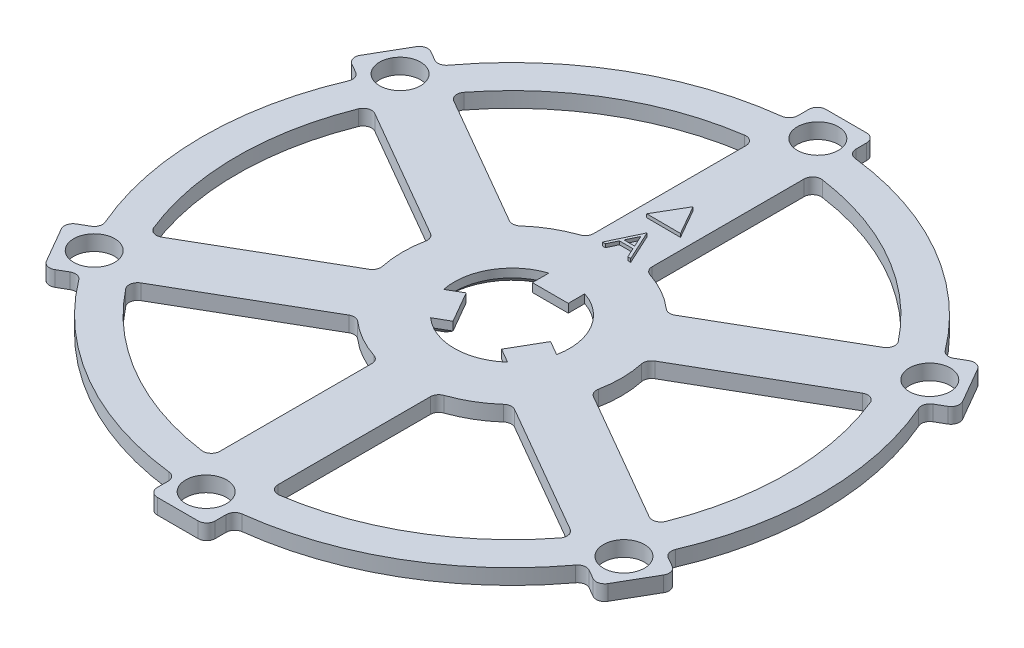
from build123d import *

# Parameters (mm, degrees)
SKETCH1_R           = 2.4
BOSS_EXTRUDE1_DEPTH = 1.8
BOSS_EXTRUDE2_DEPTH = 0.4
FILLET1_R           = 1
BOSS_EXTRUDE3_DEPTH = 0.4
CHAMFER1_SIZE       = 0.8
SCALE1_SCALE        = 1.15


with BuildPart() as part:
    # Sketch1 → Boss-Extrude1 (new body)
    with BuildSketch(Plane(origin=(0, 0, 0), x_dir=(1, 0, 0), z_dir=(0, 1, 0))):
        with BuildLine():
            Line((3.292416453, 36.059862473), (3.292416453, 39.224069502))
            Line((3.292416453, 39.224069502), (-3.487887898, 39.224069502))
            Line((-3.487887898, 39.224069502), (-3.487887898, 36.041480626))
            ThreePointArc((-3.487887898, 36.041480626), (-18.189876626, 31.309456655), (-29.582548732, 20.881247525))
            Line((-29.582548732, 20.881247525), (-32.322832402, 22.463351039))
            Line((-32.322832402, 22.463351039), (-35.712984578, 16.591435226))
            Line((-35.712984578, 16.591435226), (-32.956781761, 15.000140788))
            ThreePointArc((-32.956781761, 15.000140788), (-36.209723155, -0.098166922), (-32.874965185, -15.178614948))
            Line((-32.874965185, -15.178614948), (-35.615248855, -16.760718463))
            Line((-35.615248855, -16.760718463), (-32.22509668, -22.632634276))
            Line((-32.22509668, -22.632634276), (-29.468893863, -21.041339838))
            ThreePointArc((-29.468893863, -21.041339838), (-18.019846529, -31.407623577), (-3.292416453, -36.059862473))
            Line((-3.292416453, -36.059862473), (-3.292416453, -39.224069502))
            Line((-3.292416453, -39.224069502), (3.487887898, -39.224069502))
            Line((3.487887898, -39.224069502), (3.487887898, -36.041480626))
            ThreePointArc((3.487887898, -36.041480626), (18.189876626, -31.309456655), (29.582548732, -20.881247525))
            Line((29.582548732, -20.881247525), (32.322832402, -22.463351039))
            Line((32.322832402, -22.463351039), (35.712984578, -16.591435226))
            Line((35.712984578, -16.591435226), (32.956781761, -15.000140788))
            ThreePointArc((32.956781761, -15.000140788), (36.209723155, 0.098166922), (32.874965185, 15.178614948))
            Line((32.874965185, 15.178614948), (35.615248855, 16.760718463))
            Line((35.615248855, 16.760718463), (32.22509668, 22.632634277))
            Line((32.22509668, 22.632634277), (29.468893863, 21.041339838))
            ThreePointArc((29.468893863, 21.041339838), (18.019846529, 31.407623577), (3.292416453, 36.059862473))
        make_face()
        with Locations((0, 35.79571669)):
            Circle(SKETCH1_R, mode=Mode.SUBTRACT)
        with Locations((31, 17.897858345)):
            Circle(SKETCH1_R, mode=Mode.SUBTRACT)
        with Locations((31, -17.897858345)):
            Circle(SKETCH1_R, mode=Mode.SUBTRACT)
        with Locations((0, -35.79571669)):
            Circle(SKETCH1_R, mode=Mode.SUBTRACT)
        with Locations((-31, -17.897858345)):
            Circle(SKETCH1_R, mode=Mode.SUBTRACT)
        with Locations((-31, 17.897858345)):
            Circle(SKETCH1_R, mode=Mode.SUBTRACT)
        with BuildLine():
            Line((6.606243368, -1.385658169), (4.938012708, -0.422504748))
            Line((4.938012708, -0.422504748), (2.838012708, -4.059811444))
            Line((2.838012708, -4.059811444), (4.508004754, -5.023981801))
            ThreePointArc((4.508004754, -5.023981801), (0.003268724, -6.749999209), (-4.503136859, -5.028345496))
            Line((-4.503136859, -5.028345496), (-2.834906199, -4.065192075))
            Line((-2.834906199, -4.065192075), (-4.934906199, -0.427885379))
            Line((-4.934906199, -0.427885379), (-6.604898245, -1.392055737))
            ThreePointArc((-6.604898245, -1.392055737), (-5.847305152, 3.372168806), (-2.103106509, 6.414003665))
            Line((-2.103106509, 6.414003665), (-2.103106509, 4.487696823))
            Line((-2.103106509, 4.487696823), (2.096893491, 4.487696823))
            Line((2.096893491, 4.487696823), (2.096893491, 6.416037538))
            ThreePointArc((2.096893491, 6.416037538), (5.844036428, 3.377830402), (6.606243368, -1.385658169))
        make_face(mode=Mode.SUBTRACT)
        with BuildLine():
            Line((3.292416453, 12.36931663), (3.292416453, 32.021792033))
            ThreePointArc((3.292416453, 32.021792033), (16.010113467, 27.926894527), (25.969813588, 19.0211449))
            Line((25.969813588, 19.0211449), (8.921700828, 9.178412408))
            ThreePointArc((8.921700828, 9.178412408), (6.312022867, 11.135455416), (3.292416453, 12.36931663))
        make_face(mode=Mode.SUBTRACT)
        with BuildLine():
            Line((-3.487887898, 12.315625766), (-3.487887898, 32.001090749))
            ThreePointArc((-3.487887898, 32.001090749), (-16.180343375, 27.828612243), (-26.085477149, 18.862212305))
            Line((-26.085477149, 18.862212305), (-9.065934203, 9.035974603))
            ThreePointArc((-9.065934203, 9.035974603), (-6.487575839, 11.03409986), (-3.487887898, 12.315625766))
        make_face(mode=Mode.SUBTRACT)
        with BuildLine():
            Line((12.358350656, 3.333342027), (29.377893602, 13.159579728))
            ThreePointArc((29.377893602, 13.159579728), (32.190456842, 0.098282284), (29.457701487, -12.979945849))
            Line((29.457701487, -12.979945849), (12.409588726, -3.137213358))
            ThreePointArc((12.409588726, -3.137213358), (12.799598707, 0.101355556), (12.358350656, 3.333342027))
        make_face(mode=Mode.SUBTRACT)
        with BuildLine():
            Line((9.065934203, -9.035974603), (26.085477149, -18.862212305))
            ThreePointArc((26.085477149, -18.862212305), (16.180343375, -27.828612243), (3.487887898, -32.001090749))
            Line((3.487887898, -32.001090749), (3.487887898, -12.315625766))
            ThreePointArc((3.487887898, -12.315625766), (6.487575839, -11.03409986), (9.065934203, -9.035974603))
        make_face(mode=Mode.SUBTRACT)
        with BuildLine():
            Line((-3.292416453, -12.36931663), (-3.292416453, -32.021792033))
            ThreePointArc((-3.292416453, -32.021792033), (-16.010113467, -27.926894527), (-25.969813588, -19.0211449))
            Line((-25.969813588, -19.0211449), (-8.921700828, -9.178412408))
            ThreePointArc((-8.921700828, -9.178412408), (-6.312022867, -11.135455416), (-3.292416453, -12.36931663))
        make_face(mode=Mode.SUBTRACT)
        with BuildLine():
            Line((-12.358350656, -3.333342027), (-29.377893602, -13.159579728))
            ThreePointArc((-29.377893602, -13.159579728), (-32.190456842, -0.098282284), (-29.457701487, 12.979945849))
            Line((-29.457701487, 12.979945849), (-12.409588726, 3.137213358))
            ThreePointArc((-12.409588726, 3.137213358), (-12.799598707, -0.101355556), (-12.358350656, -3.333342027))
        make_face(mode=Mode.SUBTRACT)
    extrude(amount=BOSS_EXTRUDE1_DEPTH)

    # Sketch3 → Boss-Extrude2 (add)
    # profile 1 of 2: a face of its own
    with BuildSketch(Plane(origin=(0, 1.2, 0), x_dir=(1, 0, 0), z_dir=(0, 1, 0))):
        Polygon((0, 21.29720867), (-1.469825824, 18.751395665), (1.469825824, 18.751395665), align=None)
    # profile 2 of 2: a face of its own
    with BuildSketch(Plane(origin=(0, 1.2, 0), x_dir=(1, 0, 0), z_dir=(0, 1, 0))):
        Polygon((-0.052863928, 17.885283777), (1.562520688, 14.385283777), (1.221074374, 14.385283777), (0.703646489, 15.507078649), (-0.882992133, 15.507078649), (-1.415143575, 14.385283777), (-1.757992133, 14.385283777), (-0.097735723, 17.885283777), align=None)
        Polygon((-0.078805434, 17.20309227), (-0.712619537, 15.866053008), (0.538181745, 15.866053008), align=None, mode=Mode.SUBTRACT)
    extrude(amount=BOSS_EXTRUDE2_DEPTH)

    # Fillet1
    fillet1_edges = [part.edges().sort_by_distance(p)[0] for p in [
        (29.468893863, 0.9, -21.041339838),
        (3.292416453, 0.9, -32.021792033),
        (25.969813588, 0.9, -19.0211449),
        (29.377893602, 0.9, -13.159579728),
        (29.457701487, 0.9, 12.979945849),
        (32.22509668, 0.9, -22.632634277),
        (35.615248855, 0.9, -16.760718463),
        (32.874965185, 0.9, -15.178614948),
        (35.712984578, 0.9, 16.591435226),
        (32.956781761, 0.9, 15.000140788),
        (12.358350656, 0.9, -3.333342027),
        (12.409588726, 0.9, 3.137213358),
        (26.085477149, 0.9, 18.862212305),
        (3.487887898, 0.9, 32.001090749),
        (32.322832402, 0.9, 22.463351039),
        (29.582548732, 0.9, 20.881247525),
        (9.065934203, 0.9, 9.035974603),
        (3.487887898, 0.9, 12.315625766),
        (3.487887898, 0.9, 36.041480626),
        (3.487887898, 0.9, 39.224069502),
        (-3.292416453, 0.9, 39.224069502),
        (-3.292416453, 0.9, 36.059862473),
        (-3.292416453, 0.9, 32.021792033),
        (-8.921700828, 0.9, 9.178412408),
        (-3.292416453, 0.9, 12.36931663),
        (-25.969813588, 0.9, 19.0211449),
        (-29.468893863, 0.9, 21.041339838),
        (-32.22509668, 0.9, 22.632634276),
        (-35.615248855, 0.9, 16.760718463),
        (-32.874965185, 0.9, 15.178614948),
        (-29.377893602, 0.9, 13.159579728),
        (-29.457701487, 0.9, -12.979945849),
        (-12.358350656, 0.9, 3.333342027),
        (-12.409588726, 0.9, -3.137213358),
        (-32.956781761, 0.9, -15.000140788),
        (-35.712984578, 0.9, -16.591435226),
        (8.921700828, 0.9, -9.178412408),
        (-32.322832402, 0.9, -22.463351039),
        (3.292416453, 0.9, -36.059862473),
        (3.292416453, 0.9, -39.224069502),
        (3.292416453, 0.9, -12.36931663),
        (-26.085477149, 0.9, -18.862212305),
        (-3.487887898, 0.9, -36.041480626),
        (-29.582548732, 0.9, -20.881247525),
        (-3.487887898, 0.9, -12.315625766),
        (-9.065934203, 0.9, -9.035974603),
        (-3.487887898, 0.9, -39.224069502),
        (-3.487887898, 0.9, -32.001090749),
    ]]
    fillet(fillet1_edges, radius=FILLET1_R)

    # Sketch4 → Boss-Extrude3 (add)
    # profile 1 of 2: a face of its own
    with BuildSketch(Plane(origin=(0, 1.8, 0), x_dir=(1, 0, 0), z_dir=(0, 1, 0))):
        Polygon((0.010960332, 21.186568712), (-1.99146253, 17.756238281), (1.980502198, 17.73725443), align=None)
    # profile 2 of 2: a face of its own
    with BuildSketch(Plane(origin=(0, 1.8, 0), x_dir=(1, 0, 0), z_dir=(0, 1, 0))):
        Polygon((-0.0107219, 15.792389726), (1.604662715, 12.292389726), (1.263216401, 12.292389726), (0.745788516, 13.414184597), (-0.840850106, 13.414184597), (-1.373001548, 12.292389726), (-1.715850106, 12.292389726), (-0.055593695, 15.792389726), align=None)
        Polygon((-0.036663407, 15.110198219), (-0.670477509, 13.773158956), (0.580323773, 13.773158956), align=None, mode=Mode.SUBTRACT)
    extrude(amount=BOSS_EXTRUDE3_DEPTH)

    # Chamfer1
    chamfer1_edges = [part.edges().sort_by_distance(p)[0] for p in [
        (0.003268724, 0, 6.749999209),
        (-3.669021529, 0, 4.546768785),
        (3.673008731, 0, 4.541896623),
        (3.888012708, 0, 2.241158096),
        (5.772128038, 0, 0.904081458),
        (5.844036428, 0, -3.377830402),
        (2.096893491, 0, -5.45186718),
        (-3.884906199, 0, 2.246538727),
        (-5.769902222, 0, 0.909970558),
        (-5.847305152, 0, -3.372168806),
        (-2.103106509, 0, -5.450850244),
        (-0.003106509, 0, -4.487696823),
    ]]
    chamfer(chamfer1_edges, length=CHAMFER1_SIZE)


with BuildPart() as part_1:
    # Scale1: scaled about (-1.3481e-05, 0.904189641, -0.017865272)
    add(part.part.scale(SCALE1_SCALE).moved(Location((2.022e-06, -0.135628446, 0.002679791))))


solid = part_1.part
